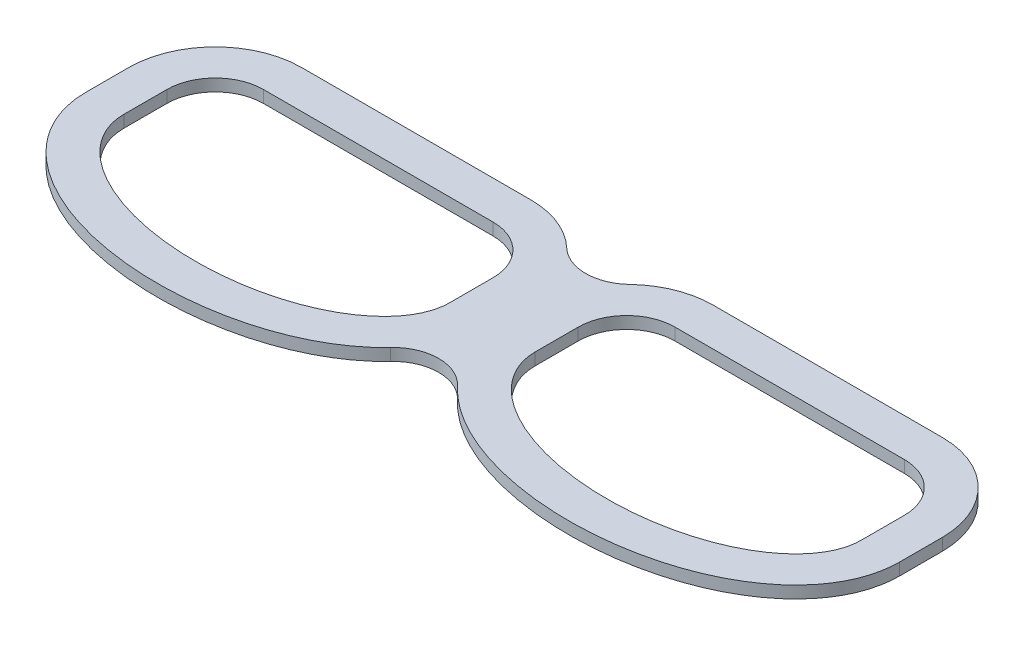
from build123d import *

# Parameters (mm, degrees)
SKETCH4_W                      = 118.3
SKETCH4_H                      = 40.5
BOSS_EXTRUDE1_DEPTH            = 12.7
CUT_EXTRUDE1_DEPTH             = 75.078168174
FILLET1_R                      = 3.175
LPATTERN1_COUNT                = 2
LPATTERN1_PITCH                = 27
FILLET1_OF_LPATTERN1_R         = 3.175
MIRROR1_DEPTH                  = 12.7
SKETCH8_R                      = 0.85
CUT_EXTRUDE2_DEPTH             = 75.078168329
MIRROR3_COPY_1_SKETCH_R        = 0.85
MIRROR3_COPY_1_DEPTH           = 75.078168329
SKETCH14_W                     = 118.3
SKETCH14_H                     = 0.96
SKETCH14_W_2                   = 4.5
SKETCH14_H_2                   = 40.5
CUT_EXTRUDE7_DEPTH             = 0.1
CUT_EXTRUDE8_DEPTH             = 2.35
MIRROR14_COPY_1_DEPTH          = 2.35
MIRROR16_COPY_1_DEPTH          = 2.35
MIRROR16_COPY_2_DEPTH          = 2.35
MIRROR16_COPY_3_DEPTH          = 2.35
CUT_EXTRUDE10_DEPTH            = 75.061089804
SKETCH20_W                     = 127.8
SKETCH20_H                     = 85.5
BOSS_EXTRUDE2_DEPTH            = 3.175
SKETCH22_W                     = 127.8
SKETCH22_H                     = 85.5
CUT_EXTRUDE11_DEPTH            = 78.923440062
CUT_EXTRUDE12_DEPTH            = 77.947080029
F_0_80_TAPPED_HOLE1_D          = 1.19126
MIRROR19_COPY_1_DEPTH          = 77.947080029
MIRROR19_COPY_2_D              = 1.19126
SKETCH26_W                     = 127.8
SKETCH26_H                     = 0.96
CUT_EXTRUDE13_DEPTH            = 3.175
SKETCH27_W                     = 127.8
SKETCH27_H                     = 0.96
CUT_EXTRUDE14_DEPTH            = 3.175
SKETCH29_W                     = 3.175
SKETCH29_H                     = 19.77
CUT_EXTRUDE15_DEPTH            = 0.82
F_0_80_TAPPED_HOLE2_AT_2_COUNT = 2
F_0_80_TAPPED_HOLE2_AT_2_PITCH = 10
SKETCH36_R                     = 0.8
CUT_EXTRUDE16_DEPTH            = 10
FILLET2_R                      = 1.5
FILLET3_R                      = 1.5
F_0_80_TAPPED_HOLE5_AT_2_COUNT = 2
F_0_80_TAPPED_HOLE5_AT_2_PITCH = 10
BOSS_EXTRUDE3_DEPTH            = 0.79375
SKETCH39_W                     = 144.663992048
SKETCH39_H                     = 99.796260463
CUT_EXTRUDE17_DEPTH            = 10


# Read off the part's stored shape, not the designer's step: Mirror1
with BuildPart() as part:
    # Sketch4 → Boss-Extrude1 (new body)
    with BuildSketch(Plane(origin=(0, 0, 0), x_dir=(1, 0, 0), z_dir=(0, 1, 0))):
        with Locations((0, 22.5)):
            Rectangle(SKETCH4_W, SKETCH4_H)
    extrude(amount=BOSS_EXTRUDE1_DEPTH)

    # Sketch5 → Cut-Extrude1 (cut, through all)
    with BuildSketch(Plane(origin=(0, 12.7, 0), x_dir=(1, 0, 0), z_dir=(0, 1, 0))):
        with BuildLine():
            Line((-54.9, 13.5), (-54.9, 7.5))
            Line((-54.9, 7.5), (-33.5, 7.5))
            Line((-33.5, 7.5), (-33.5, 13.5))
            add(Edge.make_bspline(
                [(-33.5, 13.5), (-33.5, 19.5), (-44.2, 19.5), (-54.9, 19.5), (-54.9, 13.5)],
                knots=[3.141592654, 3.141592654, 3.141592654, 4.71238898, 4.71238898, 6.283185307, 6.283185307, 6.283185307], degree=2, weights=[1, 0.707106781, 1, 0.707106781, 1]))
        make_face()
        with BuildLine():
            Line((-54.9, 37.5), (-33.5, 37.5))
            Line((-33.5, 37.5), (-33.5, 31.5))
            add(Edge.make_bspline(
                [(-54.9, 31.5), (-54.9, 25.5), (-44.2, 25.5), (-33.5, 25.5), (-33.5, 31.5)],
                knots=[0, 0, 0, 1.570796327, 1.570796327, 3.141592654, 3.141592654, 3.141592654], degree=2, weights=[1, 0.707106781, 1, 0.707106781, 1]))
            Line((-54.9, 31.5), (-54.9, 37.5))
        make_face()
    cut_extrude1 = extrude(amount=-CUT_EXTRUDE1_DEPTH, mode=Mode.SUBTRACT)

    # Fillet1
    fillet1_edges = [part.edges().sort_by_distance(p)[0] for p in [
        (-33.5, 6.35, -7.5),
        (-54.9, 6.35, -7.5),
        (-54.9, 6.35, -37.5),
        (-33.5, 6.35, -37.5),
    ]]
    fillet(fillet1_edges, radius=FILLET1_R)

    # LPattern1: Cut-Extrude1 ×2
    with Locations(*[(i * LPATTERN1_PITCH, 0, 0) for i in range(1, LPATTERN1_COUNT)]):
        add(cut_extrude1, mode=Mode.SUBTRACT)

    # Fillet1 of LPattern1
    fillet1_of_lpattern1_edges = [part.edges().sort_by_distance(p)[0] for p in [
        (-6.5, 6.35, -7.5),
        (-27.9, 6.35, -7.5),
        (-27.9, 6.35, -37.5),
        (-6.5, 6.35, -37.5),
    ]]
    fillet(fillet1_of_lpattern1_edges, radius=FILLET1_OF_LPATTERN1_R)

    # Mirror1 outline → Mirror1 (cut)
    with BuildSketch(Plane(origin=(0, 0, 0), x_dir=(1, 0, 0), z_dir=(0, 1, 0))):
        with BuildLine():
            add(Edge.make_bspline(
                [(33.5, 13.5), (33.5, 19.5), (44.2, 19.5), (54.9, 19.5), (54.9, 13.5)],
                knots=[3.141592654, 3.141592654, 3.141592654, 4.71238898, 4.71238898, 6.283185307, 6.283185307, 6.283185307], degree=2, weights=[1, 0.707106781, 1, 0.707106781, 1]))
            Line((33.5, 13.5), (33.5, 10.675))
            ThreePointArc((33.5, 10.675), (34.42993597, 8.42993597), (36.675, 7.5))
            Line((36.675, 7.5), (51.725, 7.5))
            ThreePointArc((51.725, 7.5), (53.97006403, 8.42993597), (54.9, 10.675))
            Line((54.9, 10.675), (54.9, 13.5))
        make_face()
        with BuildLine():
            add(Edge.make_bspline(
                [(54.9, 31.5), (54.9, 25.5), (44.2, 25.5), (33.5, 25.5), (33.5, 31.5)],
                knots=[0, 0, 0, 1.570796327, 1.570796327, 3.141592654, 3.141592654, 3.141592654], degree=2, weights=[1, 0.707106781, 1, 0.707106781, 1]))
            Line((54.9, 31.5), (54.9, 34.325))
            ThreePointArc((54.9, 34.325), (53.97006403, 36.57006403), (51.725, 37.5))
            Line((51.725, 37.5), (36.675, 37.5))
            ThreePointArc((36.675, 37.5), (34.42993597, 36.57006403), (33.5, 34.325))
            Line((33.5, 34.325), (33.5, 31.5))
        make_face()
        with BuildLine():
            add(Edge.make_bspline(
                [(6.5, 13.5), (6.5, 19.5), (17.2, 19.5), (27.9, 19.5), (27.9, 13.5)],
                knots=[3.141592654, 3.141592654, 3.141592654, 4.71238898, 4.71238898, 6.283185307, 6.283185307, 6.283185307], degree=2, weights=[1, 0.707106781, 1, 0.707106781, 1]))
            Line((6.5, 13.5), (6.5, 10.675))
            ThreePointArc((6.5, 10.675), (7.42993597, 8.42993597), (9.675, 7.5))
            Line((9.675, 7.5), (24.725, 7.5))
            ThreePointArc((24.725, 7.5), (26.97006403, 8.42993597), (27.9, 10.675))
            Line((27.9, 10.675), (27.9, 13.5))
        make_face()
        with BuildLine():
            add(Edge.make_bspline(
                [(27.9, 31.5), (27.9, 25.5), (17.2, 25.5), (6.5, 25.5), (6.5, 31.5)],
                knots=[0, 0, 0, 1.570796327, 1.570796327, 3.141592654, 3.141592654, 3.141592654], degree=2, weights=[1, 0.707106781, 1, 0.707106781, 1]))
            Line((27.9, 31.5), (27.9, 34.325))
            ThreePointArc((27.9, 34.325), (26.97006403, 36.57006403), (24.725, 37.5))
            Line((24.725, 37.5), (9.675, 37.5))
            ThreePointArc((9.675, 37.5), (7.42993597, 36.57006403), (6.5, 34.325))
            Line((6.5, 34.325), (6.5, 31.5))
        make_face()
    extrude(amount=MIRROR1_DEPTH, mode=Mode.SUBTRACT)

    # Sketch8 → Cut-Extrude2 (cut, through all)
    with BuildSketch(Plane(origin=(0, 12.7, 0), x_dir=(1, 0, 0), z_dir=(0, 1, 0))):
        with Locations(Location((-57.15, 40.75, 0), (0, 0, 270))):
            Circle(SKETCH8_R)
        with Locations(Location((-30.7, 40.75, 0), (0, 0, 270))):
            Circle(SKETCH8_R)
        with Locations(Location((-4.25, 40.75, 0), (0, 0, 270))):
            Circle(SKETCH8_R)
        with Locations(Location((-4.25, 24.98, 0), (0, 0, 270))):
            Circle(SKETCH8_R)
        with Locations(Location((-30.7, 24.98, 0), (0, 0, 270))):
            Circle(SKETCH8_R)
        with Locations(Location((-57.15, 24.98, 0), (0, 0, 270))):
            Circle(SKETCH8_R)
    cut_extrude2 = extrude(amount=-CUT_EXTRUDE2_DEPTH, mode=Mode.SUBTRACT)

    # Mirror2: Cut-Extrude2 across plane
    add(cut_extrude2.mirror(Plane.XY.offset(-22.5)), mode=Mode.SUBTRACT)

    # Mirror3: Cut-Extrude2 across plane
    add(cut_extrude2.mirror(Plane(origin=(0, 0, 0), x_dir=(0, 0, 1), z_dir=(1, 0, 0))), mode=Mode.SUBTRACT)

    # Mirror3 copy 1 sketch → Mirror3 copy 1 (cut, through all)
    with BuildSketch(Plane(origin=(0, 12.7, -45), x_dir=(-1, 0, 0), z_dir=(0, 1, 0))):
        with Locations(Location((-57.15, 40.75, 0), (0, 0, 270))):
            Circle(MIRROR3_COPY_1_SKETCH_R)
        with Locations(Location((-30.7, 40.75, 0), (0, 0, 270))):
            Circle(MIRROR3_COPY_1_SKETCH_R)
        with Locations(Location((-4.25, 40.75, 0), (0, 0, 270))):
            Circle(MIRROR3_COPY_1_SKETCH_R)
        with Locations(Location((-4.25, 24.98, 0), (0, 0, 270))):
            Circle(MIRROR3_COPY_1_SKETCH_R)
        with Locations(Location((-30.7, 24.98, 0), (0, 0, 270))):
            Circle(MIRROR3_COPY_1_SKETCH_R)
        with Locations(Location((-57.15, 24.98, 0), (0, 0, 270))):
            Circle(MIRROR3_COPY_1_SKETCH_R)
    extrude(amount=-MIRROR3_COPY_1_DEPTH, mode=Mode.SUBTRACT)

    # Sketch14 → Cut-Extrude7 (cut)
    with BuildSketch(Plane(origin=(0, 12.7, 0), x_dir=(1, 0, 0), z_dir=(0, 1, 0))):
        with Locations((0, 22.5)):
            Rectangle(SKETCH14_W, SKETCH14_H)
        with Locations((0, 22.5)):
            Rectangle(SKETCH14_W_2, SKETCH14_H_2)
    extrude(amount=-CUT_EXTRUDE7_DEPTH, mode=Mode.SUBTRACT)

    # Sketch15 → Cut-Extrude8 (cut)
    with BuildSketch(Plane(origin=(0, 12.7, 0), x_dir=(1, 0, 0), z_dir=(0, 1, 0))):
        with BuildLine():
            Line((-33.875, 42.75), (-27.525, 42.75))
            Line((-27.525, 42.75), (-27.525, 41.5))
            ThreePointArc((-27.525, 41.5), (-30.7, 38.325), (-33.875, 41.5))
            Line((-33.875, 41.5), (-33.875, 42.75))
        make_face()
        with BuildLine():
            Line((-2.25, 42.75), (-6.675, 42.75))
            Line((-6.675, 42.75), (-6.675, 41.5))
            ThreePointArc((-6.675, 41.5), (-5.74506403, 39.25493597), (-3.5, 38.325))
            Line((-3.5, 38.325), (-2.25, 38.325))
            Line((-2.25, 38.325), (-2.25, 42.75))
        make_face()
        with BuildLine():
            Line((-59.15, 42.75), (-54.725, 42.75))
            Line((-54.725, 42.75), (-54.725, 41.5))
            ThreePointArc((-54.725, 41.5), (-55.65493597, 39.25493597), (-57.9, 38.325))
            Line((-57.9, 38.325), (-59.15, 38.325))
            Line((-59.15, 38.325), (-59.15, 42.75))
        make_face()
    cut_extrude8 = extrude(amount=-CUT_EXTRUDE8_DEPTH, mode=Mode.SUBTRACT)

    # Mirror6: Cut-Extrude8 across plane
    add(cut_extrude8.mirror(Plane(origin=(0, 0, -32.865), x_dir=(1, 0, 0), z_dir=(0, 0, -1))), mode=Mode.SUBTRACT)

    # Mirror14: Cut-Extrude8 across plane
    add(cut_extrude8.mirror(Plane(origin=(0, 0, 0), x_dir=(0, 0, 1), z_dir=(1, 0, 0))), mode=Mode.SUBTRACT)

    # Mirror14 copy 1 sketch → Mirror14 copy 1 (cut)
    with BuildSketch(Plane(origin=(0, 12.7, -65.73), x_dir=(-1, 0, 0), z_dir=(0, 1, 0))):
        with BuildLine():
            Line((-33.875, 42.75), (-27.525, 42.75))
            Line((-27.525, 42.75), (-27.525, 41.5))
            ThreePointArc((-27.525, 41.5), (-30.7, 38.325), (-33.875, 41.5))
            Line((-33.875, 41.5), (-33.875, 42.75))
        make_face()
        with BuildLine():
            Line((-2.25, 42.75), (-6.675, 42.75))
            Line((-6.675, 42.75), (-6.675, 41.5))
            ThreePointArc((-6.675, 41.5), (-5.74506403, 39.25493597), (-3.5, 38.325))
            Line((-3.5, 38.325), (-2.25, 38.325))
            Line((-2.25, 38.325), (-2.25, 42.75))
        make_face()
        with BuildLine():
            Line((-59.15, 42.75), (-54.725, 42.75))
            Line((-54.725, 42.75), (-54.725, 41.5))
            ThreePointArc((-54.725, 41.5), (-55.65493597, 39.25493597), (-57.9, 38.325))
            Line((-57.9, 38.325), (-59.15, 38.325))
            Line((-59.15, 38.325), (-59.15, 42.75))
        make_face()
    extrude(amount=-MIRROR14_COPY_1_DEPTH, mode=Mode.SUBTRACT)

    # Mirror16: Cut-Extrude8 across plane
    add(cut_extrude8.mirror(Plane.XY.offset(-22.5)), mode=Mode.SUBTRACT)

    # Mirror16 copy 1 sketch → Mirror16 copy 1 (cut)
    with BuildSketch(Plane(origin=(0, 12.7, 20.73), x_dir=(1, 0, 0), z_dir=(0, 1, 0))):
        with BuildLine():
            Line((-33.875, 42.75), (-27.525, 42.75))
            Line((-27.525, 42.75), (-27.525, 41.5))
            ThreePointArc((-27.525, 41.5), (-30.7, 38.325), (-33.875, 41.5))
            Line((-33.875, 41.5), (-33.875, 42.75))
        make_face()
        with BuildLine():
            Line((-2.25, 42.75), (-6.675, 42.75))
            Line((-6.675, 42.75), (-6.675, 41.5))
            ThreePointArc((-6.675, 41.5), (-5.74506403, 39.25493597), (-3.5, 38.325))
            Line((-3.5, 38.325), (-2.25, 38.325))
            Line((-2.25, 38.325), (-2.25, 42.75))
        make_face()
        with BuildLine():
            Line((-59.15, 42.75), (-54.725, 42.75))
            Line((-54.725, 42.75), (-54.725, 41.5))
            ThreePointArc((-54.725, 41.5), (-55.65493597, 39.25493597), (-57.9, 38.325))
            Line((-57.9, 38.325), (-59.15, 38.325))
            Line((-59.15, 38.325), (-59.15, 42.75))
        make_face()
    extrude(amount=-MIRROR16_COPY_1_DEPTH, mode=Mode.SUBTRACT)

    # Mirror16 copy 2 sketch → Mirror16 copy 2 (cut)
    with BuildSketch(Plane(origin=(0, 12.7, -45), x_dir=(-1, 0, 0), z_dir=(0, 1, 0))):
        with BuildLine():
            Line((-33.875, 42.75), (-27.525, 42.75))
            Line((-27.525, 42.75), (-27.525, 41.5))
            ThreePointArc((-27.525, 41.5), (-30.7, 38.325), (-33.875, 41.5))
            Line((-33.875, 41.5), (-33.875, 42.75))
        make_face()
        with BuildLine():
            Line((-2.25, 42.75), (-6.675, 42.75))
            Line((-6.675, 42.75), (-6.675, 41.5))
            ThreePointArc((-6.675, 41.5), (-5.74506403, 39.25493597), (-3.5, 38.325))
            Line((-3.5, 38.325), (-2.25, 38.325))
            Line((-2.25, 38.325), (-2.25, 42.75))
        make_face()
        with BuildLine():
            Line((-59.15, 42.75), (-54.725, 42.75))
            Line((-54.725, 42.75), (-54.725, 41.5))
            ThreePointArc((-54.725, 41.5), (-55.65493597, 39.25493597), (-57.9, 38.325))
            Line((-57.9, 38.325), (-59.15, 38.325))
            Line((-59.15, 38.325), (-59.15, 42.75))
        make_face()
    extrude(amount=-MIRROR16_COPY_2_DEPTH, mode=Mode.SUBTRACT)

    # Mirror16 copy 3 sketch → Mirror16 copy 3 (cut)
    with BuildSketch(Plane(origin=(0, 12.7, 20.73), x_dir=(-1, 0, 0), z_dir=(0, 1, 0))):
        with BuildLine():
            Line((-33.875, -42.75), (-27.525, -42.75))
            Line((-27.525, -42.75), (-27.525, -41.5))
            ThreePointArc((-27.525, -41.5), (-30.7, -38.325), (-33.875, -41.5))
            Line((-33.875, -41.5), (-33.875, -42.75))
        make_face()
        with BuildLine():
            Line((-2.25, -42.75), (-6.675, -42.75))
            Line((-6.675, -42.75), (-6.675, -41.5))
            ThreePointArc((-6.675, -41.5), (-5.74506403, -39.25493597), (-3.5, -38.325))
            Line((-3.5, -38.325), (-2.25, -38.325))
            Line((-2.25, -38.325), (-2.25, -42.75))
        make_face()
        with BuildLine():
            Line((-59.15, -42.75), (-54.725, -42.75))
            Line((-54.725, -42.75), (-54.725, -41.5))
            ThreePointArc((-54.725, -41.5), (-55.65493597, -39.25493597), (-57.9, -38.325))
            Line((-57.9, -38.325), (-59.15, -38.325))
            Line((-59.15, -38.325), (-59.15, -42.75))
        make_face()
    extrude(amount=-MIRROR16_COPY_3_DEPTH, mode=Mode.SUBTRACT)

    # Sketch17 → Cut-Extrude10 (cut, through all)
    with BuildSketch(Plane(origin=(0, 12.6, 0), x_dir=(1, 0, 0), z_dir=(0, 1, 0))):
        Polygon((-54.725, 22.98), (-59.15, 22.98), (-59.15, 22.02), (-54.725, 22.02), (-33.875, 22.02), (-27.525, 22.02), (-6.675, 22.02), (-2.25, 22.02), (-2.25, 17.595), (-2.25, 6.675), (-2.25, 2.25), (2.25, 2.25), (2.25, 6.675), (2.25, 17.595), (2.25, 22.02), (6.675, 22.02), (27.525, 22.02), (33.875, 22.02), (54.725, 22.02), (59.15, 22.02), (59.15, 22.98), (54.725, 22.98), (33.875, 22.98), (27.525, 22.98), (6.675, 22.98), (2.25, 22.98), (2.25, 27.405), (2.25, 38.325), (2.25, 42.75), (-2.25, 42.75), (-2.25, 38.325), (-2.25, 27.405), (-2.25, 22.98), (-6.675, 22.98), (-27.525, 22.98), (-33.875, 22.98), align=None)
    extrude(amount=-CUT_EXTRUDE10_DEPTH, mode=Mode.SUBTRACT)


with BuildPart() as cut_extrude10_piece_1:
    # of the separate pieces the step leaves, piece 1, a body of its own (cut_extrude10_pieces)
    add(part.part.solids().sort_by_distance((59.15, 0, -22.02))[0])



with BuildPart() as cut_extrude10_piece_2:
    # of the separate pieces the step leaves, piece 2, a body of its own (cut_extrude10_pieces)
    add(part.part.solids().sort_by_distance((2.25, 0, -42.75))[0])


with BuildPart() as cut_extrude10_piece_3:
    # of the separate pieces the step leaves, piece 3, a body of its own (cut_extrude10_pieces)
    add(part.part.solids().sort_by_distance((-59.15, 0, -2.25))[0])


with BuildPart() as cut_extrude10_piece_4:
    # of the separate pieces the step leaves, piece 4, a body of its own (cut_extrude10_pieces)
    add(part.part.solids().sort_by_distance((-59.15, 0, -22.98))[0])


with BuildPart() as cut_extrude10_piece_1_1:
    add(cut_extrude10_piece_1.part)

    add(cut_extrude10_piece_2.part)  # Boss-Extrude2 merges Cut-Extrude10 piece 2

    add(cut_extrude10_piece_3.part)  # Boss-Extrude2 merges Cut-Extrude10 piece 3

    add(cut_extrude10_piece_4.part)  # Boss-Extrude2 merges Cut-Extrude10 piece 4
    # Sketch20 → Boss-Extrude2 (add)
    with BuildSketch(Plane(origin=(0, 0, 0), x_dir=(1, 0, 0), z_dir=(0, 1, 0))):
        Rectangle(SKETCH20_W, SKETCH20_H)
    extrude(amount=-BOSS_EXTRUDE2_DEPTH)

    # Sketch22 → Cut-Extrude11 (cut, through all)
    with BuildSketch(Plane(origin=(0, 0, 0), x_dir=(1, 0, 0), z_dir=(0, 1, 0))):
        Rectangle(SKETCH22_W, SKETCH22_H)
    extrude(amount=CUT_EXTRUDE11_DEPTH, mode=Mode.SUBTRACT)

    # Sketch23 → Cut-Extrude12 (cut, through all)
    with BuildSketch(Plane(origin=(0, 0, 0), x_dir=(1, 0, 0), z_dir=(0, 1, 0))):
        with BuildLine():
            Line((-36.675, 37.5), (-51.725, 37.5))
            ThreePointArc((-51.725, 37.5), (-53.97006403, 36.57006403), (-54.9, 34.325))
            Line((-54.9, 34.325), (-54.9, 31.5))
            add(Edge.make_bspline(
                [(-54.9, 31.5), (-54.9, 25.5), (-44.2, 25.5), (-33.5, 25.5), (-33.5, 31.5)],
                knots=[0, 0, 0, 1.570796327, 1.570796327, 3.141592654, 3.141592654, 3.141592654], degree=2, weights=[1, 0.707106781, 1, 0.707106781, 1]))
            Line((-33.5, 31.5), (-33.5, 34.325))
            ThreePointArc((-33.5, 34.325), (-34.42993597, 36.57006403), (-36.675, 37.5))
        make_face()
        with BuildLine():
            Line((-9.675, 37.5), (-24.725, 37.5))
            ThreePointArc((-24.725, 37.5), (-26.97006403, 36.57006403), (-27.9, 34.325))
            Line((-27.9, 34.325), (-27.9, 31.5))
            add(Edge.make_bspline(
                [(-27.9, 31.5), (-27.9, 25.5), (-17.2, 25.5), (-6.5, 25.5), (-6.5, 31.5)],
                knots=[0, 0, 0, 1.570796327, 1.570796327, 3.141592654, 3.141592654, 3.141592654], degree=2, weights=[1, 0.707106781, 1, 0.707106781, 1]))
            Line((-6.5, 31.5), (-6.5, 34.325))
            ThreePointArc((-6.5, 34.325), (-7.42993597, 36.57006403), (-9.675, 37.5))
        make_face()
        with BuildLine():
            Line((-54.9, 13.5), (-54.9, 10.675))
            ThreePointArc((-54.9, 10.675), (-53.97006403, 8.42993597), (-51.725, 7.5))
            Line((-51.725, 7.5), (-36.675, 7.5))
            ThreePointArc((-36.675, 7.5), (-34.42993597, 8.42993597), (-33.5, 10.675))
            Line((-33.5, 10.675), (-33.5, 13.5))
            add(Edge.make_bspline(
                [(-33.5, 13.5), (-33.5, 19.5), (-44.2, 19.5), (-54.9, 19.5), (-54.9, 13.5)],
                knots=[3.141592654, 3.141592654, 3.141592654, 4.71238898, 4.71238898, 6.283185307, 6.283185307, 6.283185307], degree=2, weights=[1, 0.707106781, 1, 0.707106781, 1]))
        make_face()
        with BuildLine():
            Line((-27.9, 13.5), (-27.9, 10.675))
            ThreePointArc((-27.9, 10.675), (-26.97006403, 8.42993597), (-24.725, 7.5))
            Line((-24.725, 7.5), (-9.675, 7.5))
            ThreePointArc((-9.675, 7.5), (-7.42993597, 8.42993597), (-6.5, 10.675))
            Line((-6.5, 10.675), (-6.5, 13.5))
            add(Edge.make_bspline(
                [(-6.5, 13.5), (-6.5, 19.5), (-17.2, 19.5), (-27.9, 19.5), (-27.9, 13.5)],
                knots=[3.141592654, 3.141592654, 3.141592654, 4.71238898, 4.71238898, 6.283185307, 6.283185307, 6.283185307], degree=2, weights=[1, 0.707106781, 1, 0.707106781, 1]))
        make_face()
    cut_extrude12 = extrude(amount=-CUT_EXTRUDE12_DEPTH, mode=Mode.SUBTRACT)

    # #0-80 Tapped Hole1 (through all)
    with Locations(Plane(origin=(0, 0, 0), x_dir=(1, 0, 0), z_dir=(0, 1, 0))):
        with Locations((-57.15, 40.75), (-30.7, 40.75), (-4.25, 40.75), (-4.25, 24.98), (-30.7, 24.98), (-30.7, 20.02), (-57.15, 24.98), (-57.15, 20.02), (-4.25, 20.02), (-4.25, 4.25), (-30.7, 4.25), (-57.15, 4.25)):
            f_0_80_tapped_hole1 = Hole(F_0_80_TAPPED_HOLE1_D / 2)

    # Mirror18: Cut-Extrude12, #0-80 Tapped Hole1 across plane
    add(cut_extrude12.mirror(Plane(origin=(0, 0, 0), x_dir=(0, 0, 1), z_dir=(1, 0, 0))), mode=Mode.SUBTRACT)
    add(f_0_80_tapped_hole1.mirror(Plane(origin=(0, 0, 0), x_dir=(0, 0, 1), z_dir=(1, 0, 0))), mode=Mode.SUBTRACT)

    # Mirror19: Cut-Extrude12, #0-80 Tapped Hole1 across plane
    add(cut_extrude12.mirror(Plane(origin=(0, 0, 0), x_dir=(1, 0, 0), z_dir=(0, 0, -1))), mode=Mode.SUBTRACT)
    add(f_0_80_tapped_hole1.mirror(Plane(origin=(0, 0, 0), x_dir=(1, 0, 0), z_dir=(0, 0, -1))), mode=Mode.SUBTRACT)

    # Mirror19 copy 1 sketch → Mirror19 copy 1 (cut, through all)
    with BuildSketch(Plane(origin=(0, 0, 0), x_dir=(-1, 0, 0), z_dir=(0, 1, 0))):
        with BuildLine():
            Line((-36.675, 37.5), (-51.725, 37.5))
            ThreePointArc((-51.725, 37.5), (-53.97006403, 36.57006403), (-54.9, 34.325))
            Line((-54.9, 34.325), (-54.9, 31.5))
            add(Edge.make_bspline(
                [(-54.9, 31.5), (-54.9, 25.5), (-44.2, 25.5), (-33.5, 25.5), (-33.5, 31.5)],
                knots=[0, 0, 0, 1.570796327, 1.570796327, 3.141592654, 3.141592654, 3.141592654], degree=2, weights=[1, 0.707106781, 1, 0.707106781, 1]))
            Line((-33.5, 31.5), (-33.5, 34.325))
            ThreePointArc((-33.5, 34.325), (-34.42993597, 36.57006403), (-36.675, 37.5))
        make_face()
        with BuildLine():
            Line((-9.675, 37.5), (-24.725, 37.5))
            ThreePointArc((-24.725, 37.5), (-26.97006403, 36.57006403), (-27.9, 34.325))
            Line((-27.9, 34.325), (-27.9, 31.5))
            add(Edge.make_bspline(
                [(-27.9, 31.5), (-27.9, 25.5), (-17.2, 25.5), (-6.5, 25.5), (-6.5, 31.5)],
                knots=[0, 0, 0, 1.570796327, 1.570796327, 3.141592654, 3.141592654, 3.141592654], degree=2, weights=[1, 0.707106781, 1, 0.707106781, 1]))
            Line((-6.5, 31.5), (-6.5, 34.325))
            ThreePointArc((-6.5, 34.325), (-7.42993597, 36.57006403), (-9.675, 37.5))
        make_face()
        with BuildLine():
            Line((-54.9, 13.5), (-54.9, 10.675))
            ThreePointArc((-54.9, 10.675), (-53.97006403, 8.42993597), (-51.725, 7.5))
            Line((-51.725, 7.5), (-36.675, 7.5))
            ThreePointArc((-36.675, 7.5), (-34.42993597, 8.42993597), (-33.5, 10.675))
            Line((-33.5, 10.675), (-33.5, 13.5))
            add(Edge.make_bspline(
                [(-33.5, 13.5), (-33.5, 19.5), (-44.2, 19.5), (-54.9, 19.5), (-54.9, 13.5)],
                knots=[3.141592654, 3.141592654, 3.141592654, 4.71238898, 4.71238898, 6.283185307, 6.283185307, 6.283185307], degree=2, weights=[1, 0.707106781, 1, 0.707106781, 1]))
        make_face()
        with BuildLine():
            Line((-27.9, 13.5), (-27.9, 10.675))
            ThreePointArc((-27.9, 10.675), (-26.97006403, 8.42993597), (-24.725, 7.5))
            Line((-24.725, 7.5), (-9.675, 7.5))
            ThreePointArc((-9.675, 7.5), (-7.42993597, 8.42993597), (-6.5, 10.675))
            Line((-6.5, 10.675), (-6.5, 13.5))
            add(Edge.make_bspline(
                [(-6.5, 13.5), (-6.5, 19.5), (-17.2, 19.5), (-27.9, 19.5), (-27.9, 13.5)],
                knots=[3.141592654, 3.141592654, 3.141592654, 4.71238898, 4.71238898, 6.283185307, 6.283185307, 6.283185307], degree=2, weights=[1, 0.707106781, 1, 0.707106781, 1]))
        make_face()
    extrude(amount=-MIRROR19_COPY_1_DEPTH, mode=Mode.SUBTRACT)

    # Mirror19 copy 2 (through all)
    with Locations(Plane(origin=(0, 0, 0), x_dir=(-1, 0, 0), z_dir=(0, 1, 0))):
        with Locations((-57.15, 40.75), (-30.7, 40.75), (-4.25, 40.75), (-4.25, 24.98), (-30.7, 24.98), (-30.7, 20.02), (-57.15, 24.98), (-57.15, 20.02), (-4.25, 20.02), (-4.25, 4.25), (-30.7, 4.25), (-57.15, 4.25)):
            Hole(MIRROR19_COPY_2_D / 2)

    # Sketch26 → Cut-Extrude13 (cut)
    with BuildSketch(Plane(origin=(0, 0, 0), x_dir=(1, 0, 0), z_dir=(0, 1, 0))):
        with Locations((0, 22.5)):
            Rectangle(SKETCH26_W, SKETCH26_H)
    extrude(amount=-CUT_EXTRUDE13_DEPTH, mode=Mode.SUBTRACT)


with BuildPart() as cut_extrude13_piece_1:
    # of the separate pieces the step leaves, piece 1, a body of its own (cut_extrude13_pieces)
    add(cut_extrude10_piece_1_1.part.solids().sort_by_distance((63.9, 0, -22.02))[0])

    # Sketch27 → Cut-Extrude14 (cut)
    with BuildSketch(Plane(origin=(0, 0, 0), x_dir=(1, 0, 0), z_dir=(0, 1, 0))):
        with Locations((0, -22.5)):
            Rectangle(SKETCH27_W, SKETCH27_H)
    extrude(amount=-CUT_EXTRUDE14_DEPTH, mode=Mode.SUBTRACT)


with BuildPart() as cut_extrude13_piece_2:
    # of the separate pieces the step leaves, piece 2, a body of its own (cut_extrude13_pieces)
    add(cut_extrude10_piece_1_1.part.solids().sort_by_distance((-63.9, 0, -42.75))[0])


with BuildPart() as cut_extrude14_piece_1:
    # of the separate pieces the step leaves, piece 1, a body of its own (cut_extrude14_pieces)
    add(cut_extrude13_piece_1.part.solids().sort_by_distance((63.9, 0, -22.02))[0])

    # Sketch30 → #0-80 Tapped Hole2 (revolve, cut)
    with BuildSketch(Plane(origin=(62.3125, 0, -5), x_dir=(0, 0, 1), z_dir=(1, 0, 0))):
        Polygon((0, 0), (0, 8.287890611), (0.59563, 7.93), (0.59563, 0), align=None)
    f_0_80_tapped_hole2 = revolve(axis=Axis((62.3125, 6.35, -5), (0, -1, 0)), mode=Mode.SUBTRACT)

    # #0-80 Tapped Hole2 at 2: #0-80 Tapped Hole2 ×2
    with Locations(*[(0, 0, i * F_0_80_TAPPED_HOLE2_AT_2_PITCH) for i in range(1, F_0_80_TAPPED_HOLE2_AT_2_COUNT)]):
        add(f_0_80_tapped_hole2, mode=Mode.SUBTRACT)


with BuildPart() as cut_extrude14_piece_2:
    # of the separate pieces the step leaves, piece 2, a body of its own (cut_extrude14_pieces)
    add(cut_extrude13_piece_1.part.solids().sort_by_distance((63.9, 0, 22.98))[0])


with BuildPart() as cut_extrude15_tool:
    # Sketch29 → Cut-Extrude15 (new body)
    with BuildSketch(Plane.XZ.offset(3.175)):
        with Locations((62.3125, -32.865)):
            Rectangle(SKETCH29_W, SKETCH29_H)
        with Locations((62.3125, 32.865)):
            Rectangle(SKETCH29_W, SKETCH29_H)
    cut_extrude15 = extrude(amount=-CUT_EXTRUDE15_DEPTH)


with BuildPart() as cut_extrude13_piece_2_1:
    add(cut_extrude13_piece_2.part)

    # Cut-Extrude15: cut by cut_extrude15_tool
    add(cut_extrude15_tool.part, mode=Mode.SUBTRACT)


with BuildPart() as cut_extrude14_piece_2_1:
    add(cut_extrude14_piece_2.part)

    # Cut-Extrude15: cut by cut_extrude15_tool
    add(cut_extrude15_tool.part, mode=Mode.SUBTRACT)


with BuildPart() as cut_extrude16_tool:
    # Sketch36 → Cut-Extrude16 (new body)
    with BuildSketch(Plane.XZ.offset(2.355)):
        with Locations(Location((62.3125, 37.98, 0), (0, 0, 270))):
            Circle(SKETCH36_R)
        with Locations(Location((62.3125, 25.98, 0), (0, 0, 270))):
            Circle(SKETCH36_R)
        with Locations(Location((62.3125, -25.98, 0), (0, 0, 270))):
            Circle(SKETCH36_R)
        with Locations(Location((62.3125, -37.98, 0), (0, 0, 270))):
            Circle(SKETCH36_R)
    cut_extrude16 = extrude(amount=-CUT_EXTRUDE16_DEPTH)


with BuildPart() as cut_extrude13_piece_2_2:
    add(cut_extrude13_piece_2_1.part)

    # Cut-Extrude16: cut by cut_extrude16_tool
    add(cut_extrude16_tool.part, mode=Mode.SUBTRACT)


with BuildPart() as cut_extrude14_piece_2_2:
    add(cut_extrude14_piece_2_1.part)

    # Cut-Extrude16: cut by cut_extrude16_tool
    add(cut_extrude16_tool.part, mode=Mode.SUBTRACT)


with BuildPart() as mirror20_tool:
    # Mirror20: Cut-Extrude15, #0-80 Tapped Hole2, Cut-Extrude16 across plane
    add(cut_extrude15.mirror(Plane(origin=(0, 0, 0), x_dir=(0, 0, 1), z_dir=(1, 0, 0))))
    add(f_0_80_tapped_hole2.mirror(Plane(origin=(0, 0, 0), x_dir=(0, 0, 1), z_dir=(1, 0, 0))))
    add(cut_extrude16.mirror(Plane(origin=(0, 0, 0), x_dir=(0, 0, 1), z_dir=(1, 0, 0))))


with BuildPart() as cut_extrude13_piece_2_3:
    add(cut_extrude13_piece_2_2.part)

    # Mirror20: cut by mirror20_tool
    add(mirror20_tool.part, mode=Mode.SUBTRACT)

    # Fillet2
    fillet2_edges = [cut_extrude13_piece_2_3.edges().sort_by_distance(p)[0] for p in [
        (-63.9, -1.1775, -42.75),
        (63.9, -1.1775, -42.75),
    ]]
    fillet(fillet2_edges, radius=FILLET2_R)

    # Sketch28 → Boss-Extrude3 (add)
    with BuildSketch(Plane(origin=(0, 0, 0), x_dir=(1, 0, 0), z_dir=(0, 1, 0))):
        with BuildLine():
            Line((-36.675, 40), (-51.725, 40))
            ThreePointArc((-51.725, 40), (-55.737830983, 38.337830983), (-57.4, 34.325))
            Line((-57.4, 34.325), (-57.4, 31.5))
            add(Edge.make_bspline(
                [(-57.4, 31.5), (-57.4, 30.821154279), (-57.153175896, 29.447143081), (-56.167212938, 27.665270484), (-54.756272745, 26.202813776), (-52.455453984, 24.642995601), (-48.951428942, 23.350815489), (-44.2, 22.824592255), (-39.448571058, 23.350815489), (-35.944546016, 24.642995601), (-34.049903108, 25.927450724), (-33.266838465, 26.626794184), (-33.008008702, 26.88800086), (-32.892921678, 27.01127891)],
                knots=[0, 0, 0, 0, 0.196349541, 0.392699082, 0.589048623, 0.785398163, 1.178097245, 1.570796327, 1.963495408, 2.35619449, 2.552544031, 2.61024303, 2.659330415, 2.659330415, 2.659330415, 2.659330415], degree=3))
            ThreePointArc((-32.892921678, 27.01127891), (-30.7, 27.964062625), (-28.507078322, 27.01127891))
            add(Edge.make_bspline(
                [(-28.507078322, 27.01127891), (-28.391991298, 26.88800086), (-28.133161535, 26.626794184), (-27.350096892, 25.927450724), (-25.455453984, 24.642995601), (-21.951428942, 23.350815489), (-17.2, 22.824592255), (-12.448571058, 23.350815489), (-8.944546016, 24.642995601), (-6.643727255, 26.202813776), (-5.232787062, 27.665270484), (-4.246824104, 29.447143081), (-4, 30.821154279), (-4, 31.5)],
                knots=[0.482262239, 0.482262239, 0.482262239, 0.482262239, 0.531349624, 0.589048623, 0.785398163, 1.178097245, 1.570796327, 1.963495408, 2.35619449, 2.552544031, 2.748893572, 2.945243113, 3.141592654, 3.141592654, 3.141592654, 3.141592654], degree=3))
            Line((-4, 31.5), (-4, 34.325))
            ThreePointArc((-4, 34.325), (-5.662169017, 38.337830983), (-9.675, 40))
            Line((-9.675, 40), (-24.725, 40))
            ThreePointArc((-24.725, 40), (-26.829389725, 39.595405002), (-28.633717579, 38.439310621))
            ThreePointArc((-28.633717579, 38.439310621), (-30.7, 37.614276588), (-32.766282421, 38.439310621))
            ThreePointArc((-32.766282421, 38.439310621), (-34.570610275, 39.595405002), (-36.675, 40))
        make_face()
        with BuildLine():
            Line((-33.5, 31.5), (-33.5, 34.325))
            ThreePointArc((-33.5, 34.325), (-34.42993597, 36.57006403), (-36.675, 37.5))
            Line((-36.675, 37.5), (-51.725, 37.5))
            ThreePointArc((-51.725, 37.5), (-53.97006403, 36.57006403), (-54.9, 34.325))
            Line((-54.9, 34.325), (-54.9, 31.5))
            add(Edge.make_bspline(
                [(-54.9, 31.5), (-54.9, 25.5), (-44.2, 25.5), (-33.5, 25.5), (-33.5, 31.5)],
                knots=[0, 0, 0, 1.570796327, 1.570796327, 3.141592654, 3.141592654, 3.141592654], degree=2, weights=[1, 0.707106781, 1, 0.707106781, 1]))
        make_face(mode=Mode.SUBTRACT)
        with BuildLine():
            Line((-9.675, 37.5), (-24.725, 37.5))
            ThreePointArc((-24.725, 37.5), (-26.97006403, 36.57006403), (-27.9, 34.325))
            Line((-27.9, 34.325), (-27.9, 31.5))
            add(Edge.make_bspline(
                [(-27.9, 31.5), (-27.9, 25.5), (-17.2, 25.5), (-6.5, 25.5), (-6.5, 31.5)],
                knots=[0, 0, 0, 1.570796327, 1.570796327, 3.141592654, 3.141592654, 3.141592654], degree=2, weights=[1, 0.707106781, 1, 0.707106781, 1]))
            Line((-6.5, 31.5), (-6.5, 34.325))
            ThreePointArc((-6.5, 34.325), (-7.42993597, 36.57006403), (-9.675, 37.5))
        make_face(mode=Mode.SUBTRACT)
    extrude(amount=BOSS_EXTRUDE3_DEPTH)


with BuildPart() as cut_extrude14_piece_1_1:
    add(cut_extrude14_piece_1.part)

    # Mirror20: cut by mirror20_tool
    add(mirror20_tool.part, mode=Mode.SUBTRACT)

    # Mirror20 copy 1 sketch → Mirror20 copy 1 (revolve, cut)
    with BuildSketch(Plane(origin=(-62.3125, 0, 5), x_dir=(0, 0, 1), z_dir=(-1, 0, 0))):
        Polygon((0, 0), (0, -8.287890611), (0.59563, -7.93), (0.59563, 0), align=None)
    revolve(axis=Axis((-62.3125, 6.35, 5), (0, 1, 0)), mode=Mode.SUBTRACT)

    # Sketch37 → #0-80 Tapped Hole5 (revolve, cut)
    with BuildSketch(Plane(origin=(0, 0, -5), x_dir=(0, 0, 1), z_dir=(1, 0, 0))):
        Polygon((0, 0), (0, 8.287890611), (0.59563, 7.93), (0.59563, 0), align=None)
    f_0_80_tapped_hole5 = revolve(axis=Axis((0, 6.35, -5), (0, -1, 0)), mode=Mode.SUBTRACT)

    # #0-80 Tapped Hole5 at 2: #0-80 Tapped Hole5 ×2
    with Locations(*[(0, 0, i * F_0_80_TAPPED_HOLE5_AT_2_PITCH) for i in range(1, F_0_80_TAPPED_HOLE5_AT_2_COUNT)]):
        add(f_0_80_tapped_hole5, mode=Mode.SUBTRACT)


with BuildPart() as cut_extrude14_piece_2_3:
    add(cut_extrude14_piece_2_2.part)

    # Mirror20: cut by mirror20_tool
    add(mirror20_tool.part, mode=Mode.SUBTRACT)

    # Fillet3
    fillet3_edges = [cut_extrude14_piece_2_3.edges().sort_by_distance(p)[0] for p in [
        (63.9, -1.1775, 42.75),
        (-63.9, -1.1775, 42.75),
    ]]
    fillet(fillet3_edges, radius=FILLET3_R)


with BuildPart() as cut_extrude17_tool:
    # Sketch39 → Cut-Extrude17 (new body)
    with BuildSketch(Plane(origin=(0, 0, 0), x_dir=(1, 0, 0), z_dir=(0, 1, 0))):
        with Locations((1.301429901, 2.173123287)):
            Rectangle(SKETCH39_W, SKETCH39_H)
    extrude(amount=-CUT_EXTRUDE17_DEPTH)


with BuildPart() as cut_extrude13_piece_2_4:
    add(cut_extrude13_piece_2_3.part)

    # Cut-Extrude17: cut by cut_extrude17_tool
    add(cut_extrude17_tool.part, mode=Mode.SUBTRACT)


with BuildPart() as cut_extrude14_piece_1_2:
    add(cut_extrude14_piece_1_1.part)

    # Cut-Extrude17: cut by cut_extrude17_tool
    add(cut_extrude17_tool.part, mode=Mode.SUBTRACT)


with BuildPart() as cut_extrude14_piece_2_4:
    add(cut_extrude14_piece_2_3.part)

    # Cut-Extrude17: cut by cut_extrude17_tool
    add(cut_extrude17_tool.part, mode=Mode.SUBTRACT)


solid = cut_extrude13_piece_2_4.part
